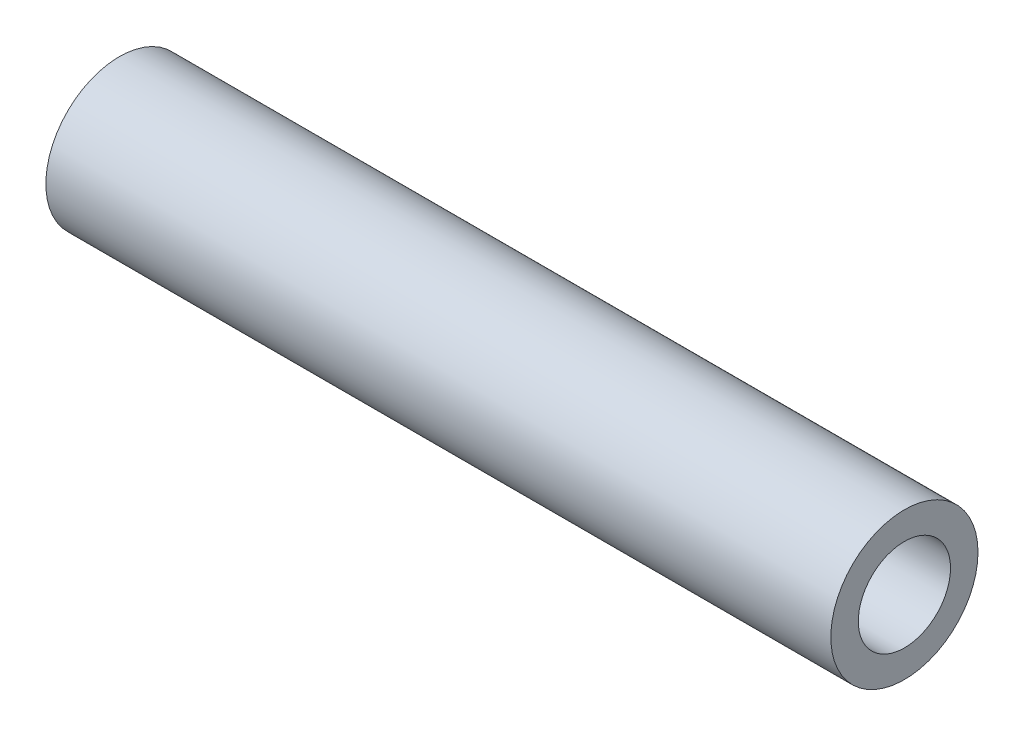
from build123d import *

# Parameters (mm, degrees)
SKETCH1_R           = 4.7625
SKETCH1_R_2         = 2.9845
BOSS_EXTRUDE1_DEPTH = 50.8


with BuildPart() as part:
    # Sketch1 → Boss-Extrude1 (new body)
    with BuildSketch(Plane(origin=(0, 0, 0), x_dir=(0, 0, -1), z_dir=(1, 0, 0))):
        Circle(SKETCH1_R)
        Circle(SKETCH1_R_2, mode=Mode.SUBTRACT)
    extrude(amount=BOSS_EXTRUDE1_DEPTH)


solid = part.part
